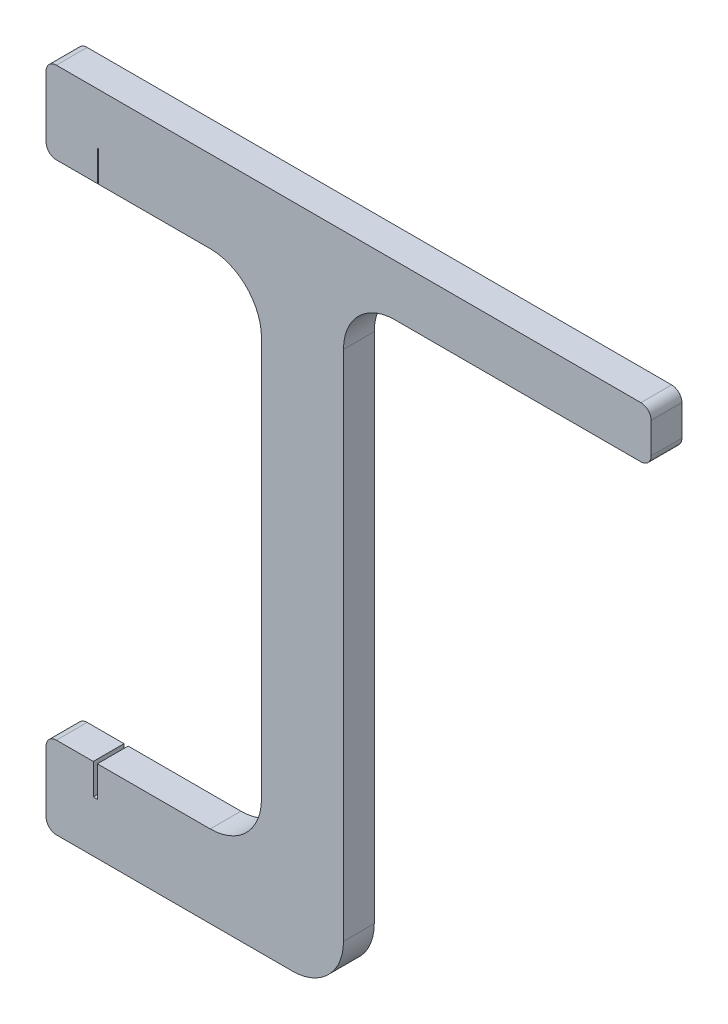
from build123d import *

# Parameters (mm, degrees)
BOSS_EXTRUDE1_DEPTH = 3
SKETCH2_W           = 0.4
SKETCH2_H           = 3
CUT_EXTRUDE5_DEPTH  = 3
SKETCH3_W           = 0.1
SKETCH3_H           = 3
CUT_EXTRUDE6_DEPTH  = 3


with BuildPart() as part:
    # Sketch1 → Boss-Extrude1 (new body)
    with BuildSketch(Plane.XY):
        with BuildLine():
            Line((1, 0), (24, 0))
            Line((24, 0), (29, 0))
            Line((29, 0), (58, 0))
            ThreePointArc((58, 0), (58.707106781, -0.292893219), (59, -1))
            Line((59, -1), (59, -4))
            ThreePointArc((59, -4), (58.707106781, -4.707106781), (58, -5))
            Line((58, -5), (34, -5))
            ThreePointArc((34, -5), (30.464466094, -6.464466094), (29, -10))
            Line((29, -10), (29, -60))
            ThreePointArc((29, -60), (27.535533906, -63.535533906), (24, -65))
            Line((24, -65), (1, -65))
            ThreePointArc((1, -65), (0.292893219, -64.707106781), (0, -64))
            Line((0, -64), (0, -58))
            ThreePointArc((0, -58), (0.292893219, -57.292893219), (1, -57))
            Line((1, -57), (16, -57))
            ThreePointArc((16, -57), (19.535533906, -55.535533906), (21, -52))
            Line((21, -52), (21, -13))
            ThreePointArc((21, -13), (19.535533906, -9.464466094), (16, -8))
            Line((16, -8), (1, -8))
            ThreePointArc((1, -8), (0.292893219, -7.707106781), (0, -7))
            Line((0, -7), (0, -1))
            ThreePointArc((0, -1), (0.292893219, -0.292893219), (1, 0))
        make_face()
    extrude(amount=BOSS_EXTRUDE1_DEPTH)

    # Sketch2 → Cut-Extrude5 (cut)
    with BuildSketch(Plane(origin=(0, -57, 0), x_dir=(1, 0, 0), z_dir=(0, 1, 0))):
        with Locations((4.8, -1.5)):
            Rectangle(SKETCH2_W, SKETCH2_H)
    extrude(amount=-CUT_EXTRUDE5_DEPTH, mode=Mode.SUBTRACT)

    # Sketch3 → Cut-Extrude6 (cut)
    with BuildSketch(Plane.XZ.offset(8)):
        with Locations((5.05, 1.5)):
            Rectangle(SKETCH3_W, SKETCH3_H)
    extrude(amount=-CUT_EXTRUDE6_DEPTH, mode=Mode.SUBTRACT)


solid = part.part
